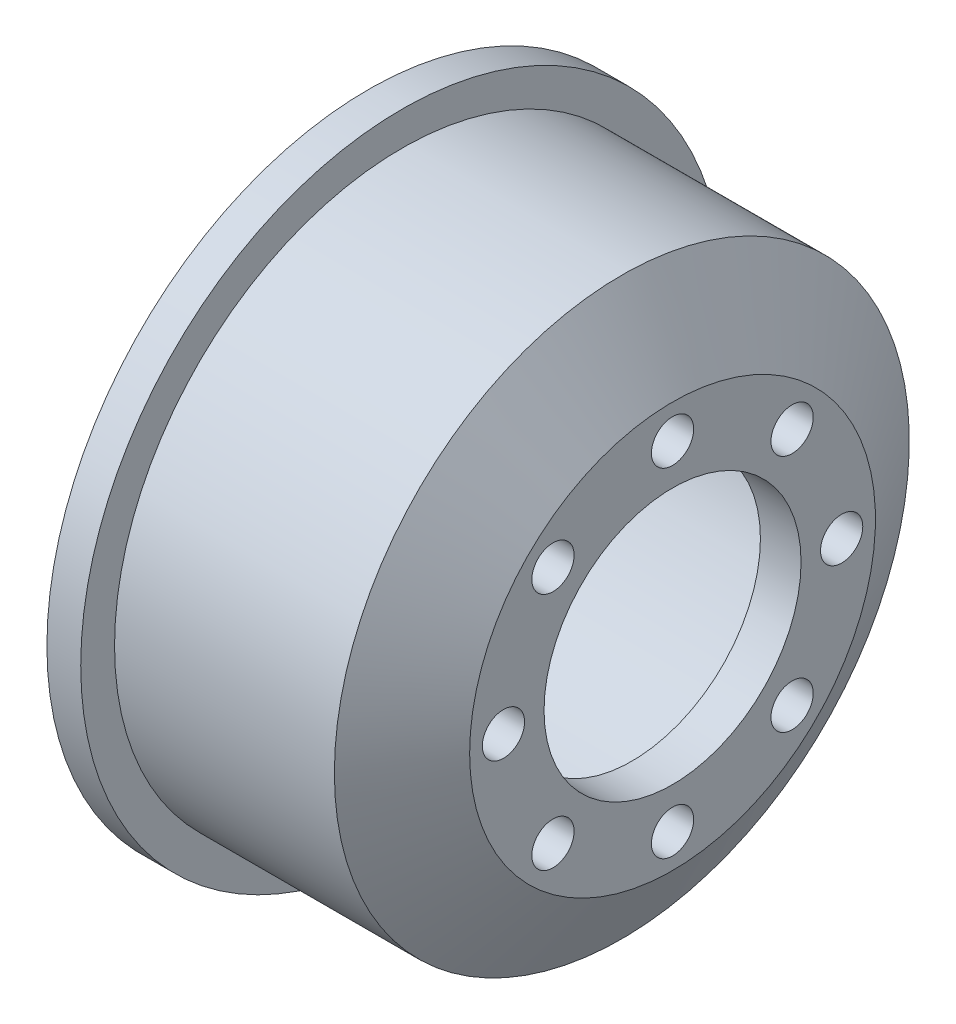
from build123d import *

# Parameters (mm, degrees)
SKETCH11_R         = 1.25
CUT_EXTRUDE9_DEPTH = 33.341923258


with BuildPart() as part:
    # Sketch1 → Revolve1 (revolve)
    with BuildSketch(Plane(origin=(0, 0, 0), x_dir=(1, 0, 0), z_dir=(0, 1, 0))):
        Polygon((10.139813159, 7.6), (10.139813159, 12), (7.139813159, 17), (-5.860186841, 17), (-5.860186841, 19), (-7.360186841, 19), (-7.860186841, 19), (-7.860186841, 18), (-7.360186841, 18), (-7.360186841, 16.55), (-7.360186841, 14.55), (6.089935015, 14.55), (7.736367227, 11.805946314), (7.736367227, 7.6), align=None)
    revolve(axis=Axis((-37.278866169, 0, 0), (1, 0, 0)))

    # Sketch11 → Cut-Extrude9 (cut, through all)
    with BuildSketch(Plane(origin=(10.139813159, 0, 0), x_dir=(0, 0, -1), z_dir=(1, 0, 0))):
        with Locations((0, 10)):
            Circle(SKETCH11_R)
        with Locations((7.071067812, 7.071067812)):
            Circle(SKETCH11_R)
        with Locations((10, 0)):
            Circle(SKETCH11_R)
        with Locations((7.071067812, -7.071067812)):
            Circle(SKETCH11_R)
        with Locations((0, -10)):
            Circle(SKETCH11_R)
        with Locations((-7.071067812, -7.071067812)):
            Circle(SKETCH11_R)
        with Locations((-10, 0)):
            Circle(SKETCH11_R)
        with Locations((-7.071067812, 7.071067812)):
            Circle(SKETCH11_R)
    extrude(amount=-CUT_EXTRUDE9_DEPTH, mode=Mode.SUBTRACT)


solid = part.part
